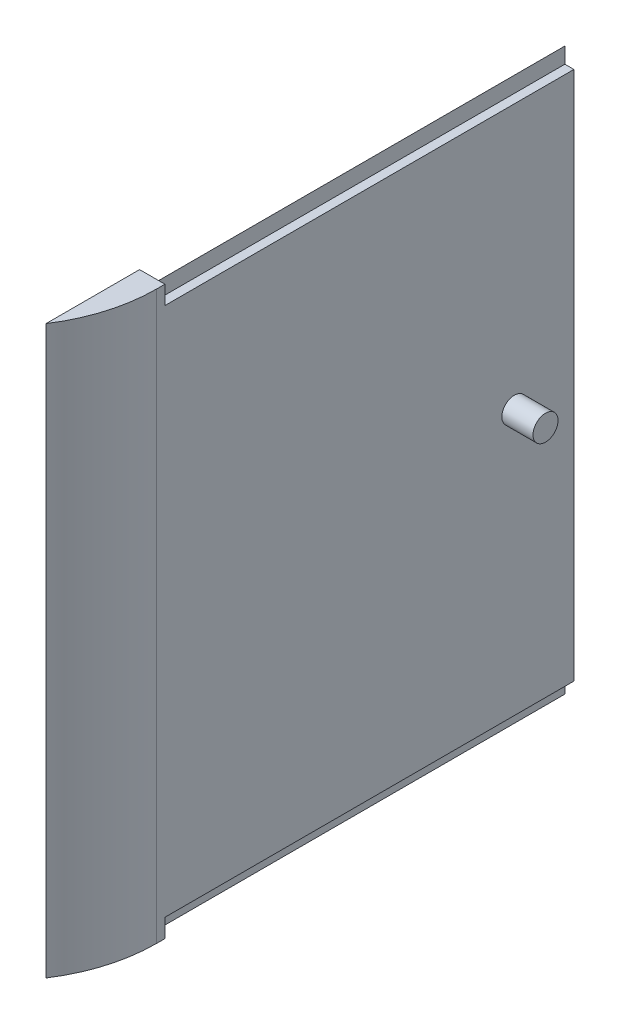
from build123d import *

# Parameters (mm, degrees)
BOSS_EXTRUDE1_DEPTH = 105
BOSS_EXTRUDE2_DEPTH = 24
FILLET1_R           = 40
SKETCH5_R           = 3.219097994
BOSS_EXTRUDE3_DEPTH = 8


with BuildPart() as part:
    # Sketch1 → Boss-Extrude1 (new body)
    with BuildSketch(Plane.XY):
        Polygon((37.684072543, -12), (37.684072543, -7.95), (33.684072543, -12), (33.684072543, -148), (37.684072543, -152.05), (37.684072543, -148), (40, -148), (40, -12), align=None)
    extrude(amount=-BOSS_EXTRUDE1_DEPTH)

    # Sketch4 → Boss-Extrude2 (add)
    with BuildSketch(Plane.XY):
        Polygon((40, -152.75), (33.5, -152.75), (33.5, -7.25), (40, -7.25), (40, -80), align=None)
    extrude(amount=BOSS_EXTRUDE2_DEPTH)

    # Fillet1
    # the kernel refuses this fillet: 40 mm, written as the material it takes off along each edge
    with BuildSketch(Plane(origin=(40, 47.393732486, 24), x_dir=(0, 0, -1), z_dir=(0, -1, 0))) as fillet1_piece_1:
        with BuildLine():
            CenterArc((21.857492994, -40), FILLET1_R, 90, 33.122940208)
            Line((0, -6.5), (-0.43714986, -5.83))
            ThreePointArc((-0.43714986, -5.83), (-0.8, -3.25), (-0.8, 0))
            Line((-0.8, 0), (0, 0.8))
            Line((0, 0.8), (21.857492994, 0.8))
            Line((21.857492994, 0.8), (21.857492994, 0))
        make_face()
    extrude(amount=254.787464972, mode=Mode.SUBTRACT)

    # Sketch5 → Boss-Extrude3 (add)
    with BuildSketch(Plane(origin=(40, 0, 0), x_dir=(0, 0, -1), z_dir=(1, 0, 0))):
        with Locations((89.714756259, -80)):
            Circle(SKETCH5_R)
    extrude(amount=BOSS_EXTRUDE3_DEPTH)


solid = part.part
